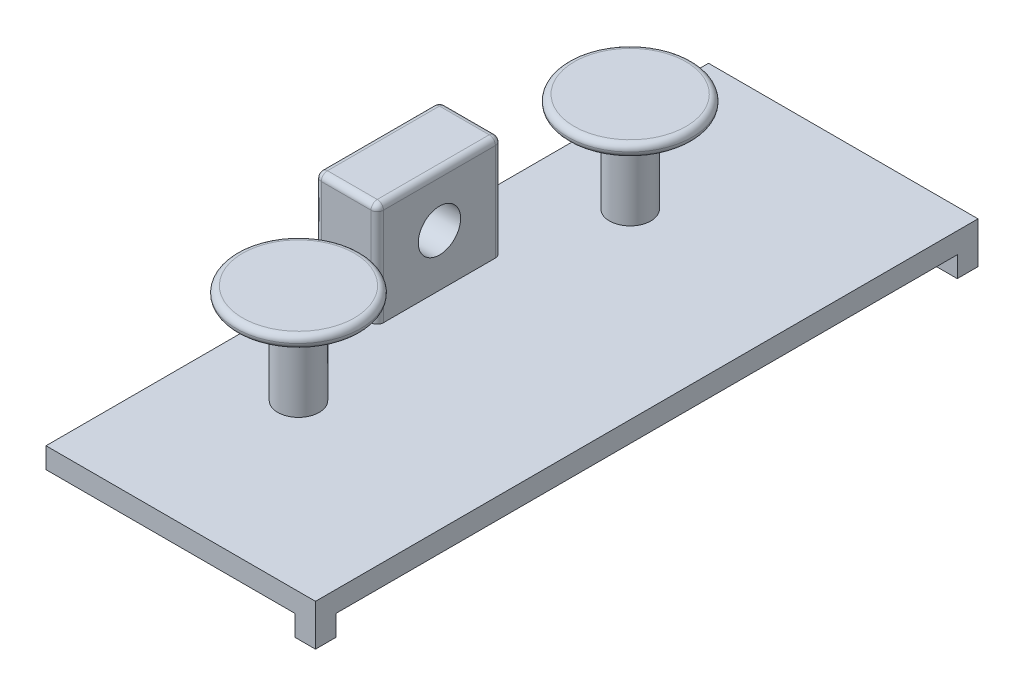
from build123d import *

# Parameters (mm, degrees)
SKETCH1_W           = 65
SKETCH1_H           = 159.8
BOSS_EXTRUDE1_DEPTH = 2.5
SKETCH2_W           = 15
SKETCH2_H           = 30
BOSS_EXTRUDE2_DEPTH = 25
SKETCH3_R           = 5.1
CUT_EXTRUDE1_DEPTH  = 107.607973435
SKETCH6_W           = 5
SKETCH6_H           = 5
BOSS_EXTRUDE4_DEPTH = 5
SKETCH7_R           = 5
BOSS_EXTRUDE5_DEPTH = 21
SKETCH8_R           = 15
BOSS_EXTRUDE6_DEPTH = 3
FILLET1_R           = 1.5
CHAMFER1_SIZE       = 1.5
FILLET2_R           = 1.5


with BuildPart() as part:
    # Sketch1 → Boss-Extrude1 (new, symmetric)
    with BuildSketch(Plane(origin=(0, 0, 0), x_dir=(1, 0, 0), z_dir=(0, 1, 0))):
        Rectangle(SKETCH1_W, SKETCH1_H)
    extrude(amount=BOSS_EXTRUDE1_DEPTH, both=True)

    # Sketch2 → Boss-Extrude2 (add)
    with BuildSketch(Plane(origin=(0, 2.5, 0), x_dir=(1, 0, 0), z_dir=(0, 1, 0))):
        with Locations((-25, 0)):
            Rectangle(SKETCH2_W, SKETCH2_H)
    extrude(amount=BOSS_EXTRUDE2_DEPTH)

    # Sketch3 → Cut-Extrude1 (cut, through all)
    with BuildSketch(Plane.ZY.offset(32.5)):
        with Locations((0, 15)):
            Circle(SKETCH3_R)
    extrude(amount=-CUT_EXTRUDE1_DEPTH, mode=Mode.SUBTRACT)

    # Sketch6 → Boss-Extrude4 (add)
    with BuildSketch(Plane.XZ.offset(2.5)):
        with Locations((30, 77.4)):
            Rectangle(SKETCH6_W, SKETCH6_H)
        with Locations((30, -77.4)):
            Rectangle(SKETCH6_W, SKETCH6_H)
    extrude(amount=BOSS_EXTRUDE4_DEPTH)

    # Sketch7 → Boss-Extrude5 (add)
    with BuildSketch(Plane(origin=(0, 2.5, 0), x_dir=(1, 0, 0), z_dir=(0, 1, 0))):
        with Locations(Location((-11.5, 40, 0), (0, 0, 90))):
            Circle(SKETCH7_R)
        with Locations(Location((-11.5, -40, 0), (0, 0, 90))):
            Circle(SKETCH7_R)
    extrude(amount=BOSS_EXTRUDE5_DEPTH)

    # Sketch8 → Boss-Extrude6 (add)
    with BuildSketch(Plane(origin=(0, 23.5, 0), x_dir=(1, 0, 0), z_dir=(0, 1, 0))):
        with Locations(Location((-11.5, 40, 0), (0, 0, 270))):
            Circle(SKETCH8_R)
        with Locations(Location((-11.5, -40, 0), (0, 0, 90))):
            Circle(SKETCH8_R)
    extrude(amount=BOSS_EXTRUDE6_DEPTH)

    # Fillet1
    fillet1_edges = [part.edges().sort_by_distance(p)[0] for p in [
        (-11.5, 23.5, -55),
        (-11.5, 26.5, -55),
        (-11.5, 23.5, 55),
        (-11.5, 26.5, 55),
    ]]
    fillet(fillet1_edges, radius=FILLET1_R - 0.0001)  # a hair under: the kernel refuses the full size

    # Chamfer1
    chamfer1_edges = [part.edges().sort_by_distance(p)[0] for p in [
        (-32.5, 15, -5.1),
    ]]
    chamfer(chamfer1_edges, length=CHAMFER1_SIZE)

    # Fillet2
    fillet2_edges = [part.edges().sort_by_distance(p)[0] for p in [
        (-32.5, 15, -15),
        (-32.5, 15, 15),
        (-17.5, 15, 15),
        (-17.5, 15, -15),
        (-32.5, 27.5, 0),
        (-25, 27.5, 15),
        (-17.5, 27.5, 0),
        (-25, 27.5, -15),
    ]]
    fillet(fillet2_edges, radius=FILLET2_R)


solid = part.part
